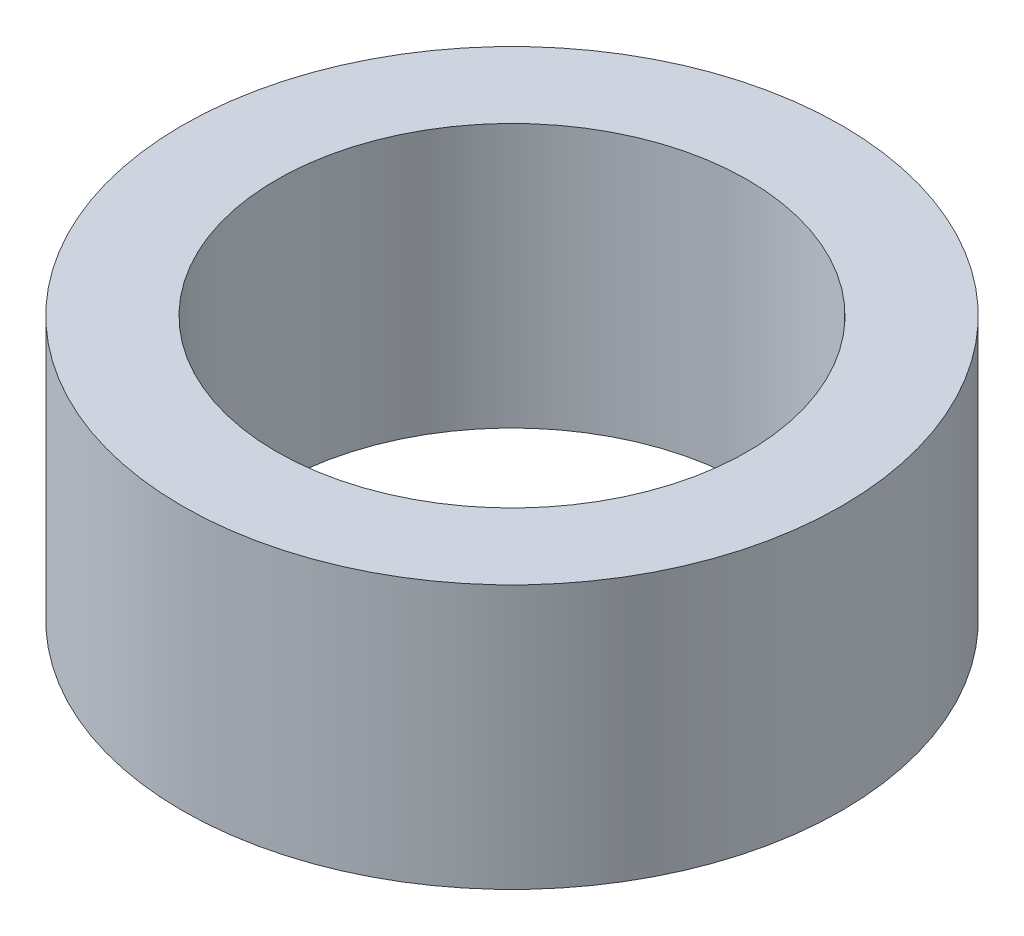
from build123d import *

# Parameters (mm, degrees)
SKETCH1_R           = 35
BOSS_EXTRUDE1_DEPTH = 28
SKETCH2_R           = 25
CUT_EXTRUDE1_DEPTH  = 57.868268832


with BuildPart() as part:
    # Sketch1 → Boss-Extrude1 (new body)
    with BuildSketch(Plane(origin=(0, 0, 0), x_dir=(1, 0, 0), z_dir=(0, 1, 0))):
        Circle(SKETCH1_R)
    extrude(amount=BOSS_EXTRUDE1_DEPTH)

    # Sketch2 → Cut-Extrude1 (cut, through all)
    with BuildSketch(Plane(origin=(0, 0, 0), x_dir=(1, 0, 0), z_dir=(0, 1, 0))):
        Circle(SKETCH2_R)
    extrude(amount=CUT_EXTRUDE1_DEPTH, mode=Mode.SUBTRACT)


solid = part.part
